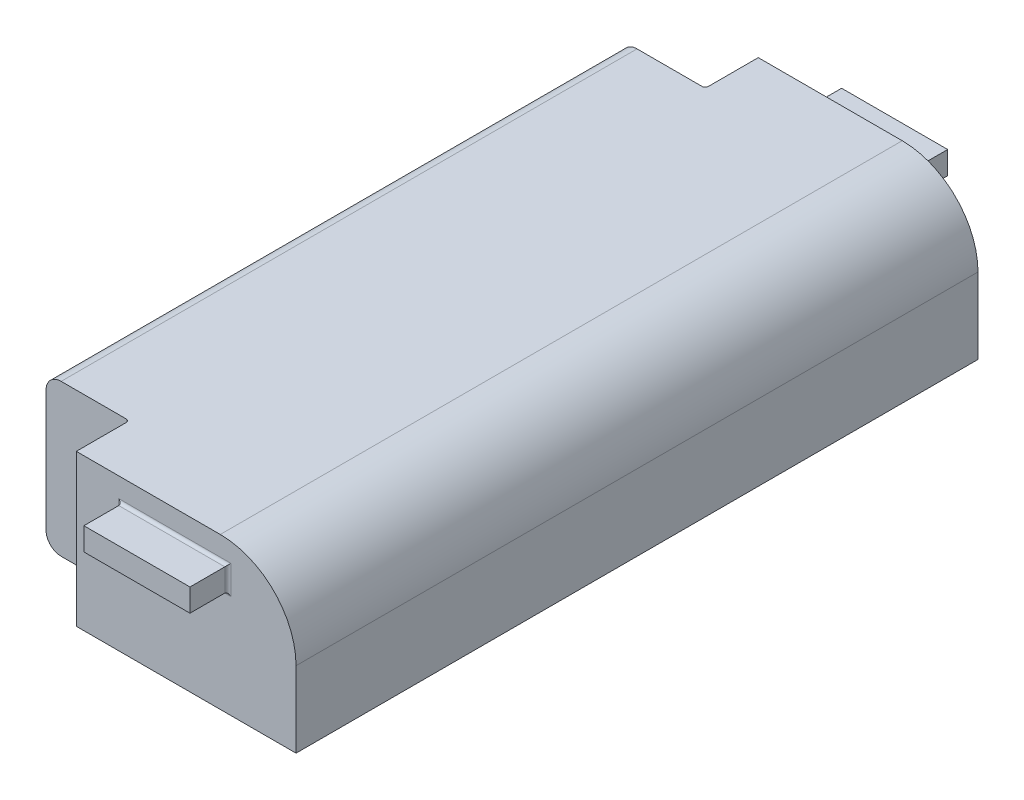
from build123d import *

# Parameters (mm, degrees)
BOSS_EXTRUDE1_DEPTH = 96.52
SKETCH3_W           = 36.83
SKETCH3_H           = 25.4
BOSS_EXTRUDE3_DEPTH = 8.89
SKETCH2_W           = 17.78
SKETCH2_H           = 3.81
BOSS_EXTRUDE4_DEPTH = 6.35
FILLET1_R           = 12.7
FILLET2_R           = 2.54
FILLET3_R           = 0.508


with BuildPart() as part:
    # Sketch1 → Boss-Extrude1 (new body)
    with BuildSketch(Plane.XY):
        Polygon((0, 0), (0, -19.05), (-7.62, -19.05), (-7.62, 6.35), (43.18, 6.35), (43.18, -19.05), (6.35, -19.05), (6.35, 0), align=None)
    extrude(amount=BOSS_EXTRUDE1_DEPTH)

    # Sketch3 → Boss-Extrude3 (add)
    with BuildSketch(Plane.XY.offset(96.52)):
        with Locations((24.765, -6.35)):
            Rectangle(SKETCH3_W, SKETCH3_H)
    boss_extrude3 = extrude(amount=BOSS_EXTRUDE3_DEPTH)

    # Sketch2 → Boss-Extrude4 (add)
    with BuildSketch(Plane(origin=(0, 0, 105.41), x_dir=(-1, 0, 0), z_dir=(0, 0, -1))):
        with Locations((-22.86, 0.635)):
            Rectangle(SKETCH2_W, SKETCH2_H)
    boss_extrude4 = extrude(amount=-BOSS_EXTRUDE4_DEPTH)

    # Mirror2: Boss-Extrude3, Boss-Extrude4 across plane
    add(boss_extrude3.mirror(Plane(origin=(0, 0, 48.26), x_dir=(1, 0, 0), z_dir=(0, 0, -1))))
    add(boss_extrude4.mirror(Plane(origin=(0, 0, 48.26), x_dir=(1, 0, 0), z_dir=(0, 0, -1))))

    # Fillet1
    fillet1_edges = [part.edges().sort_by_distance(p)[0] for p in [
        (43.18, 6.35, 48.26),
    ]]
    fillet(fillet1_edges, radius=FILLET1_R)

    # Fillet2
    fillet2_edges = [part.edges().sort_by_distance(p)[0] for p in [
        (-7.62, -19.05, 48.26),
        (-7.62, 6.35, 48.26),
    ]]
    fillet(fillet2_edges, radius=FILLET2_R)

    # Fillet3
    fillet3_edges = [part.edges().sort_by_distance(p)[0] for p in [
        (6.35, 3.175, 0),
        (6.35, 3.175, 96.52),
        (13.97, 0.635, 105.41),
        (22.86, -1.27, 105.41),
        (22.86, 2.54, 105.41),
        (31.75, 0.635, 105.41),
        (13.97, 0.635, -8.89),
        (22.86, 2.54, -8.89),
        (31.75, 0.635, -8.89),
        (22.86, -1.27, -8.89),
        (0, 0, 48.26),
        (6.35, 0, 48.26),
    ]]
    fillet(fillet3_edges, radius=FILLET3_R)


solid = part.part
